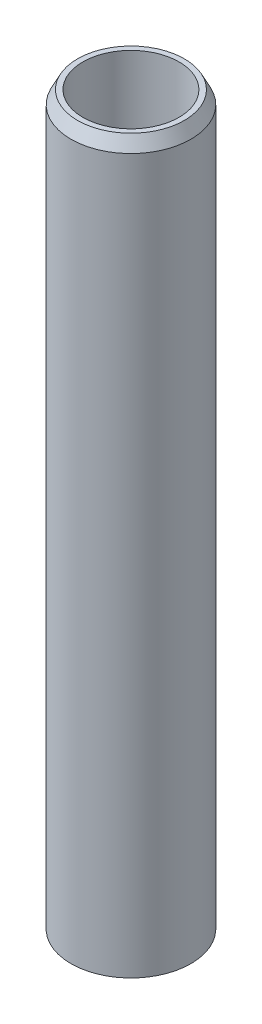
from build123d import *

# Parameters (mm, degrees)
SKETCH1_R           = 25
BOSS_EXTRUDE1_DEPTH = 305.765995
SKETCH2_R           = 20.043083367
CUT_EXTRUDE1_DEPTH  = 308.803254853
CHAMFER1_SIZE       = 5.420901
CHAMFER1_SIZE_2     = 2.735853


with BuildPart() as part:
    # Sketch1 → Boss-Extrude1 (new body)
    with BuildSketch(Plane(origin=(0, 0, 0), x_dir=(1, 0, 0), z_dir=(0, 1, 0))):
        with Locations(Location((0, 0, 0), (0, 0, 270))):
            Circle(SKETCH1_R)
    extrude(amount=BOSS_EXTRUDE1_DEPTH)

    # Sketch2 → Cut-Extrude1 (cut, through all)
    with BuildSketch(Plane(origin=(0, 0, 0), x_dir=(1, 0, 0), z_dir=(0, 1, 0))):
        with Locations(Location((0, 0, 0), (0, 0, 270))):
            Circle(SKETCH2_R)
    extrude(amount=CUT_EXTRUDE1_DEPTH, mode=Mode.SUBTRACT)

    # Chamfer1
    # the kernel refuses this chamfer: 5.420901, 2.735853 mm, written as the material it takes off along each edge
    with BuildSketch(Plane(origin=(0, 305.765995, 0), x_dir=(0, 0, 1), z_dir=(-1, 0, 0))) as chamfer1_piece_1:
        Polygon((25, -CHAMFER1_SIZE), (25 - CHAMFER1_SIZE_2, 0), (25, 0), align=None)
    revolve(axis=Axis((0, 305.765995, 0), (0, 1, 0)), mode=Mode.SUBTRACT)
    with BuildSketch(Plane(origin=(0, 0, 0), x_dir=(0, 0, 1), z_dir=(-1, 0, 0))) as chamfer1_piece_2:
        Polygon((25, CHAMFER1_SIZE_2), (25 - CHAMFER1_SIZE, 0), (25, 0), align=None)
    revolve(axis=Axis((0, 0, 0), (0, 1, 0)), mode=Mode.SUBTRACT)


solid = part.part
